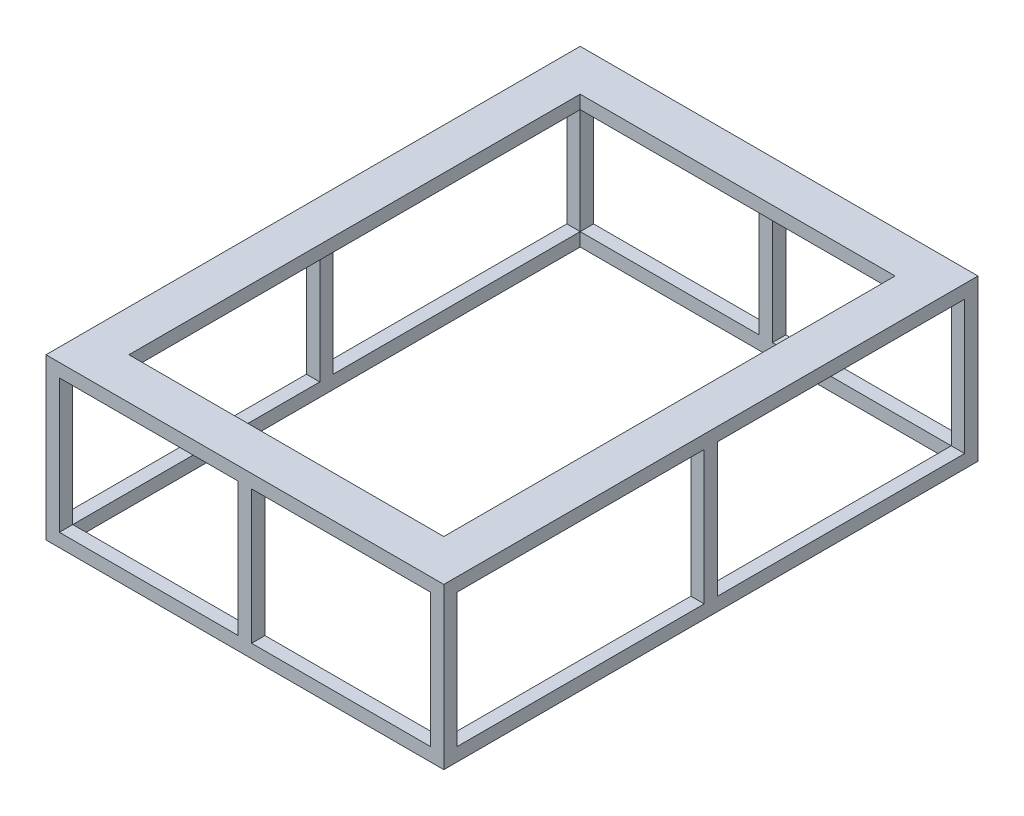
from build123d import *

# Parameters (mm, degrees)
SKETCH1_W           = 297.5
SKETCH1_H           = 399.5
SKETCH1_W_2         = 277.5
SKETCH1_H_2         = 379.5
BOSS_EXTRUDE1_DEPTH = 10
SKETCH2_W           = 10
SKETCH2_H           = 10
BOSS_EXTRUDE2_DEPTH = 100
SKETCH3_W           = 297.5
SKETCH3_H           = 399.5
SKETCH3_W_2         = 235.5
SKETCH3_H_2         = 337.5
BOSS_EXTRUDE3_DEPTH = 10


with BuildPart() as part:
    # Sketch1 → Boss-Extrude1 (new body)
    with BuildSketch(Plane(origin=(0, 0, 0), x_dir=(1, 0, 0), z_dir=(0, 1, 0))):
        with Locations((126.75, 177.75)):
            Rectangle(SKETCH1_W, SKETCH1_H)
        with Locations((126.75, 177.75)):
            Rectangle(SKETCH1_W_2, SKETCH1_H_2, mode=Mode.SUBTRACT)
    extrude(amount=BOSS_EXTRUDE1_DEPTH)

    # Sketch2 → Boss-Extrude2 (add)
    with BuildSketch(Plane(origin=(0, 10, 0), x_dir=(1, 0, 0), z_dir=(0, 1, 0))):
        with Locations((126.75, -17)):
            Rectangle(SKETCH2_W, SKETCH2_H)
        with Locations((270.5, -17)):
            Rectangle(SKETCH2_W, SKETCH2_H)
        with Locations((-17, -17)):
            Rectangle(SKETCH2_W, SKETCH2_H)
        with Locations((-17, 372.5)):
            Rectangle(SKETCH2_W, SKETCH2_H)
        with Locations((270.5, 372.5)):
            Rectangle(SKETCH2_W, SKETCH2_H)
        with Locations((126.75, 372.5)):
            Rectangle(SKETCH2_W, SKETCH2_H)
        with Locations((270.5, 177.75)):
            Rectangle(SKETCH2_W, SKETCH2_H)
        with Locations((-17, 177.75)):
            Rectangle(SKETCH2_W, SKETCH2_H)
    extrude(amount=BOSS_EXTRUDE2_DEPTH)

    # Sketch3 → Boss-Extrude3 (add)
    with BuildSketch(Plane(origin=(0, 110, 0), x_dir=(1, 0, 0), z_dir=(0, 1, 0))):
        with Locations((126.75, 177.75)):
            Rectangle(SKETCH3_W, SKETCH3_H)
        with Locations((126.75, 177.75)):
            Rectangle(SKETCH3_W_2, SKETCH3_H_2, mode=Mode.SUBTRACT)
    extrude(amount=BOSS_EXTRUDE3_DEPTH)


solid = part.part
